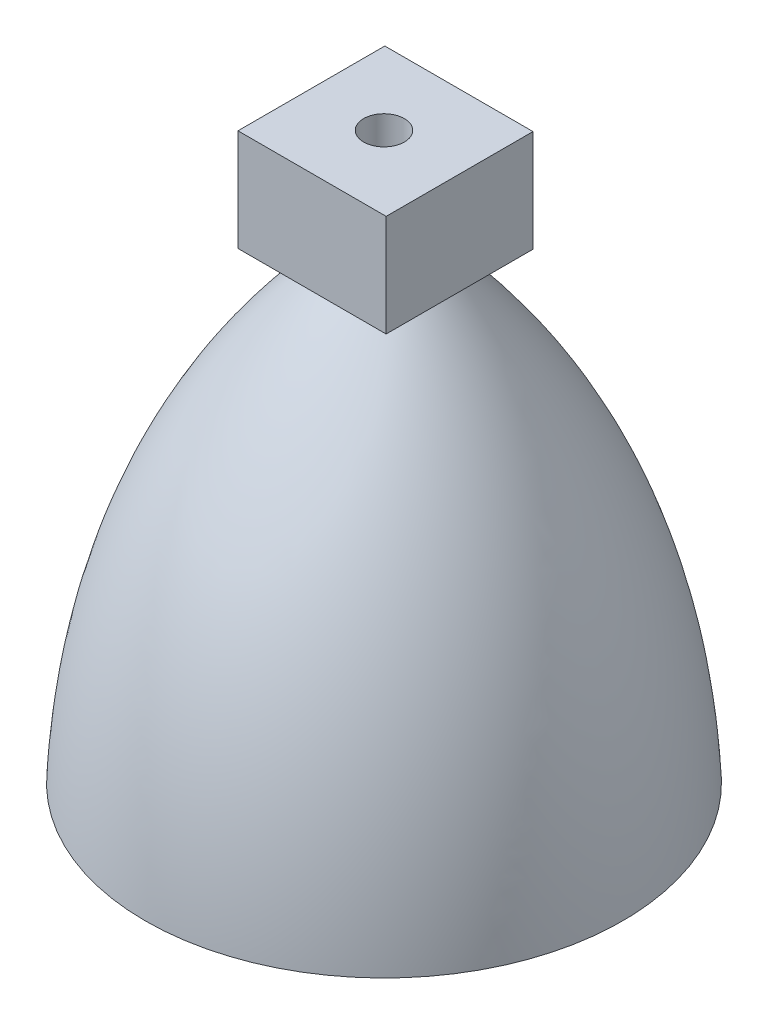
from build123d import *

# Parameters (mm, degrees)
REVOLVE_THIN1_OUTLINE_W   = 10
REVOLVE_THIN1_OUTLINE_H   = 4.190294711
REVOLVE_THIN1_OUTLINE_H_2 = 25.430398101
SKETCH4_W                 = 50.454885555
SKETCH4_H                 = 34.702925128
BOSS_EXTRUDE1_DEPTH       = 25
SKETCH5_R                 = 6.92656428
CUT_EXTRUDE1_DEPTH        = 50


# Read off the part's stored shape, not the designer's step: Revolve-Thin1
with BuildPart() as part:
    # Revolve-Thin1 outline → Revolve-Thin1 (revolve)
    with BuildSketch(Plane.XY):
        with BuildLine():
            Line((12.572695835, -4.190294711), (2.572695835, -4.190294711))
            add(Edge.make_bspline(
                [(2.572695835, -4.190294711), (3.256803477, -4.863264231), (4.111938029, -5.704476131), (5.052586036, -6.629809221), (5.351883129, -6.924233386), (5.480153312, -7.050415171), (5.565666767, -7.134536361), (5.60649606, -7.174703671), (5.975784665, -7.538349261), (7.610779142, -9.157595772), (9.214355978, -10.792063367), (11.18191941, -12.844557715), (11.880423743, -13.582762852), (12.572695835, -14.324008024)],
                knots=[0, 0, 0, 0, 0.015625, 0.01953125, 0.021484375, 0.022460937, 0.022460937, 0.0234375, 0.0234375, 0.03125, 0.0625, 0.0625, 0.079939883, 0.079939883, 0.079939883, 0.079939883], degree=3))
            Line((12.572695835, -14.324008024), (12.572695835, -4.190294711))
        make_face()
        with Locations((7.572695835, -2.095147355)):
            Rectangle(REVOLVE_THIN1_OUTLINE_W, REVOLVE_THIN1_OUTLINE_H)
        with BuildLine():
            Line((12.572695835, -4.190294711), (12.572695835, -14.324008024))
            add(Edge.make_bspline(
                [(12.572695835, -14.324008024), (14.361346695, -16.239192574), (16.108392925, -18.174671527), (22.545566832, -25.556112446), (26.95842293, -31.138237836), (39.252867809, -48.361072942), (46.191672462, -60.477354516), (57.598611585, -86.045280246), (62.066987666, -99.498416997), (68.499575811, -127.673184033), (70.487892964, -142.381255893), (71.247958055, -157.804064752)],
                knots=[0.079939883, 0.079939883, 0.079939883, 0.079939883, 0.125, 0.125, 0.25, 0.25, 0.5, 0.5, 0.75, 0.75, 0.997458266, 0.997458266, 0.997458266, 0.997458266], degree=3))
            Line((71.247958055, -157.804064752), (71.270990011, -157.804064752))
            Line((71.270990011, -157.804064752), (71.270990011, -96.986600276))
            add(Edge.make_bspline(
                [(16.732968649, -4.190294711), (55.715421715, -44.398968265), (71.270990011, -96.986600276)],
                knots=[0.032914248, 0.032914248, 0.032914248, 0.659474661, 0.659474661, 0.659474661], degree=2))
            Line((16.732968649, -4.190294711), (12.572695835, -4.190294711))
        make_face()
        with Locations((7.572695835, 12.715199051)):
            Rectangle(REVOLVE_THIN1_OUTLINE_W, REVOLVE_THIN1_OUTLINE_H_2)
        with BuildLine():
            Line((12.572695835, 0), (12.572695835, -4.190294711))
            Line((12.572695835, -4.190294711), (16.732968649, -4.190294711))
            add(Edge.make_bspline(
                [(12.572695835, 0), (14.685156347, -2.078067033), (16.732968649, -4.190294711)],
                knots=[0, 0, 0, 0.032914248, 0.032914248, 0.032914248], degree=2))
        make_face()
        with BuildLine():
            Line((71.270990011, -157.804064752), (71.247958055, -157.804064752))
            add(Edge.make_bspline(
                [(71.247958055, -157.804064752), (71.255764961, -157.96247806), (71.263442286, -158.120966773), (71.270990011, -158.279530915)],
                knots=[0.997458266, 0.997458266, 0.997458266, 0.997458266, 1, 1, 1, 1], degree=3))
            Line((71.270990011, -158.279530915), (71.270990011, -157.804064752))
        make_face()
        Polygon((71.270990011, -157.804064752), (71.270990011, -158.279530915), (81.259680211, -157.804064752), align=None)
        with BuildLine():
            Line((71.270990011, -96.986600276), (71.270990011, -157.804064752))
            Line((71.270990011, -157.804064752), (81.259680211, -157.804064752))
            add(Edge.make_bspline(
                [(71.270990011, -96.986600276), (79.725187008, -125.567118335), (81.259680211, -157.804064752)],
                knots=[0.659474661, 0.659474661, 0.659474661, 1, 1, 1], degree=2))
        make_face()
    revolve(axis=Axis((0, 0, 0), (0, 1, 0)))

    # Sketch4 → Boss-Extrude1 (add, symmetric)
    with BuildSketch(Plane.XY):
        with Locations((0.507285531, 17.351462564)):
            Rectangle(SKETCH4_W, SKETCH4_H)
    extrude(amount=BOSS_EXTRUDE1_DEPTH, both=True)

    # Sketch5 → Cut-Extrude1 (cut)
    with BuildSketch(Plane(origin=(0, 34.702925128, 0), x_dir=(1, 0, 0), z_dir=(0, 1, 0))):
        with Locations(Location((0, 0, 0), (0, 0, 270))):
            Circle(SKETCH5_R)
    extrude(amount=-CUT_EXTRUDE1_DEPTH, mode=Mode.SUBTRACT)


solid = part.part
